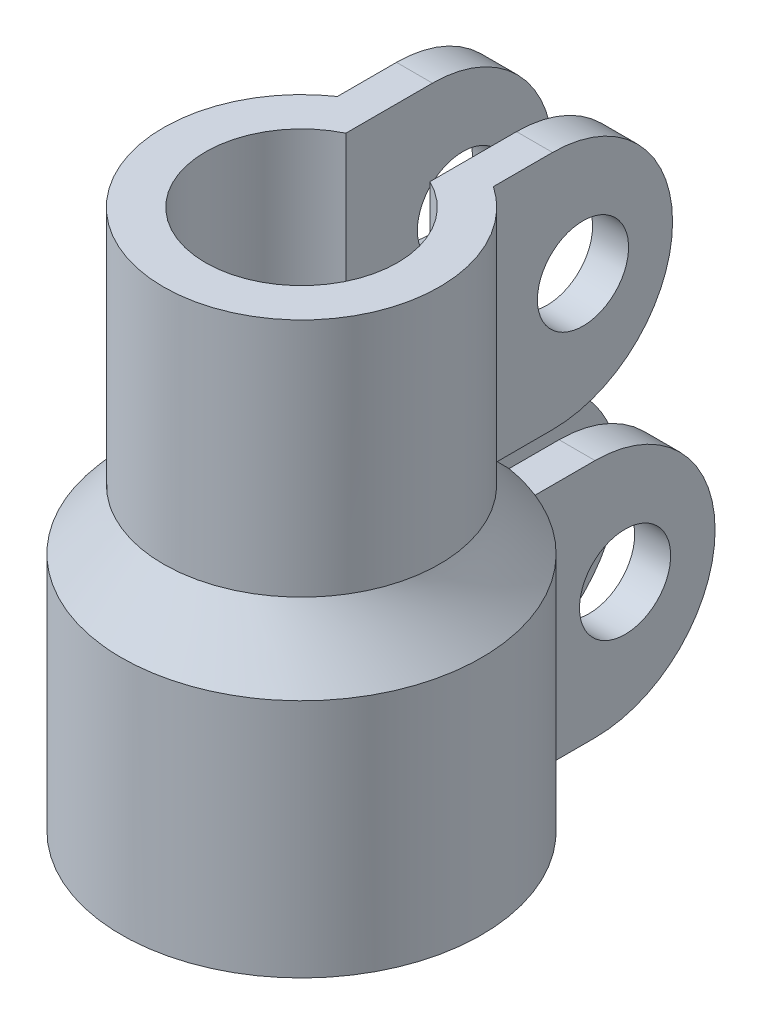
from build123d import *

# Parameters (mm, degrees)
BOSS_EXTRUDE1_DEPTH   = 10
BOSS_EXTRUDE2_DEPTH   = 10
F_6_CLEARANCE_HOLE1_D = 3.7973
F_6_CLEARANCE_HOLE2_D = 3.7973
FILLET1_R             = 5


with BuildPart() as part:
    # Sketch1 → Boss-Extrude1 (new body)
    with BuildSketch(Plane(origin=(0, 0, 0), x_dir=(1, 0, 0), z_dir=(0, 1, 0))):
        with BuildLine():
            Line((-1.25, 14.477642868), (-1.25, 5.868347297))
            ThreePointArc((-1.25, 5.868347297), (0, -6), (1.25, 5.868347297))
            Line((1.25, 5.868347297), (1.25, 14.477642868))
            Line((1.25, 14.477642868), (2.75, 14.477642868))
            Line((2.75, 14.477642868), (2.75, 6.977642868))
            ThreePointArc((2.75, 6.977642868), (0, -7.5), (-2.75, 6.977642868))
            Line((-2.75, 6.977642868), (-2.75, 14.477642868))
            Line((-2.75, 14.477642868), (-1.25, 14.477642868))
        make_face()
    extrude(amount=BOSS_EXTRUDE1_DEPTH)

    # Loft1: read off the stored shape, not the designer's step
    # Loft1: loft between two sections, ruled curve by curve
    loft1_from = [
        Edge.make_bspline([(1.25, 10, -5.868347297), (10.900494926, 10, -3.812722767), (9.866997746, 10, 6), (-9.866997746, 10, 6), (-10.900494926, 10, -3.812722767), (-1.25, 10, -5.868347297)], [0, 0, 0, 0, 0.5, 0.5, 1, 1, 1, 1], 3, [1, 0.162539502, 0.065529731, 0.065529731, 0.162539502, 1]),
        Edge.make_bspline([(-1.25, 10, -7.395099729), (-13.876567029, 10, -5.260820359), (-12.805676217, 10, 7.5), (12.805676217, 10, 7.5), (13.876567029, 10, -5.260820359), (1.25, 10, -7.395099729)], [0, 0, 0, 0, 0.5, 0.5, 1, 1, 1, 1], 3, [1, 0.151386494, 0.058902089, 0.058902089, 0.151386494, 1]),
        Edge.make_line((-1.25, 10, -7.395099729), (-1.25, 10, -5.868347297)),
        Edge.make_line((1.25, 10, -5.868347297), (1.25, 10, -7.395099729)),
    ]
    loft1_to = [
        Edge.make_bspline([(3, 12.5, -3.010398645), (6.15488313, 12.5, 0.133586757), (4.453979318, 12.5, 4.25), (-4.453979318, 12.5, 4.25), (-6.15488313, 12.5, 0.133586757), (-3, 12.5, -3.010398645)], [0, 0, 0, 0, 0.5, 0.5, 1, 1, 1, 1], 3, [1, 0.345653128, 0.203217328, 0.203217328, 0.345653128, 1]),
        Edge.make_bspline([(-3, 12.5, -4.905354218), (-9.124128689, 12.5, -1.159980234), (-7.178633469, 12.5, 5.75), (7.178633469, 12.5, 5.75), (9.124128689, 12.5, -1.159980234), (3, 12.5, -4.905354218)], [0, 0, 0, 0, 0.5, 0.5, 1, 1, 1, 1], 3, [1, 0.264204167, 0.135803041, 0.135803041, 0.264204167, 1]),
        Edge.make_line((-3, 12.5, -4.905354218), (-3, 12.5, -3.010398645)),
        Edge.make_line((3, 12.5, -3.010398645), (3, 12.5, -4.905354218)),
    ]
    loft1 = Solid(Shell([*[Face.make_surface_from_curves(loft1_from[k], loft1_to[k]) for k in range(4)], Face(Wire(loft1_from)), Face(Wire(loft1_to))]))
    add(loft1)

    # Sketch4 → Boss-Extrude2 (add)
    with BuildSketch(Plane(origin=(0, 12.5, 0), x_dir=(1, 0, 0), z_dir=(0, 1, 0))):
        with BuildLine():
            Line((-1.75, 5.123626074), (-1.75, 12.206169214))
            Line((-1.75, 12.206169214), (-3.25, 12.206169214))
            Line((-3.25, 12.206169214), (-3.25, 4.74341649))
            ThreePointArc((-3.25, 4.74341649), (0, -5.75), (3.25, 4.74341649))
            Line((3.25, 4.74341649), (3.25, 12.206169214))
            Line((3.25, 12.206169214), (1.75, 12.206169214))
            Line((1.75, 12.206169214), (1.75, 5.123626074))
            Line((1.75, 5.123626074), (1.75, 3.596873642))
            ThreePointArc((1.75, 3.596873642), (0, -4), (-1.75, 3.596873642))
            Line((-1.75, 3.596873642), (-1.75, 5.123626074))
        make_face()
    extrude(amount=BOSS_EXTRUDE2_DEPTH)

    # #6 Clearance Hole1 (through all)
    with Locations(Plane.ZY.offset(2.75)):
        with Locations((-10.727642082, 5)):
            Hole(F_6_CLEARANCE_HOLE1_D / 2)

    # #6 Clearance Hole2 (through all)
    with Locations(Plane.ZY.offset(3.25)):
        with Locations((-8.474792852, 17.5)):
            Hole(F_6_CLEARANCE_HOLE2_D / 2)

    # Fillet1
    fillet1_edges = [part.edges().sort_by_distance(p)[0] for p in [
        (2, 0, -14.477642868),
        (-2, 0, -14.477642868),
        (-2.5, 12.5, -12.206169214),
        (2.5, 12.5, -12.206169214),
        (-2.5, 22.5, -12.206169214),
        (2.5, 22.5, -12.206169214),
        (2, 10, -14.477642868),
        (-2, 10, -14.477642868),
    ]]
    fillet(fillet1_edges, radius=FILLET1_R - 0.0001)  # a hair under: the kernel refuses the full size


solid = part.part
